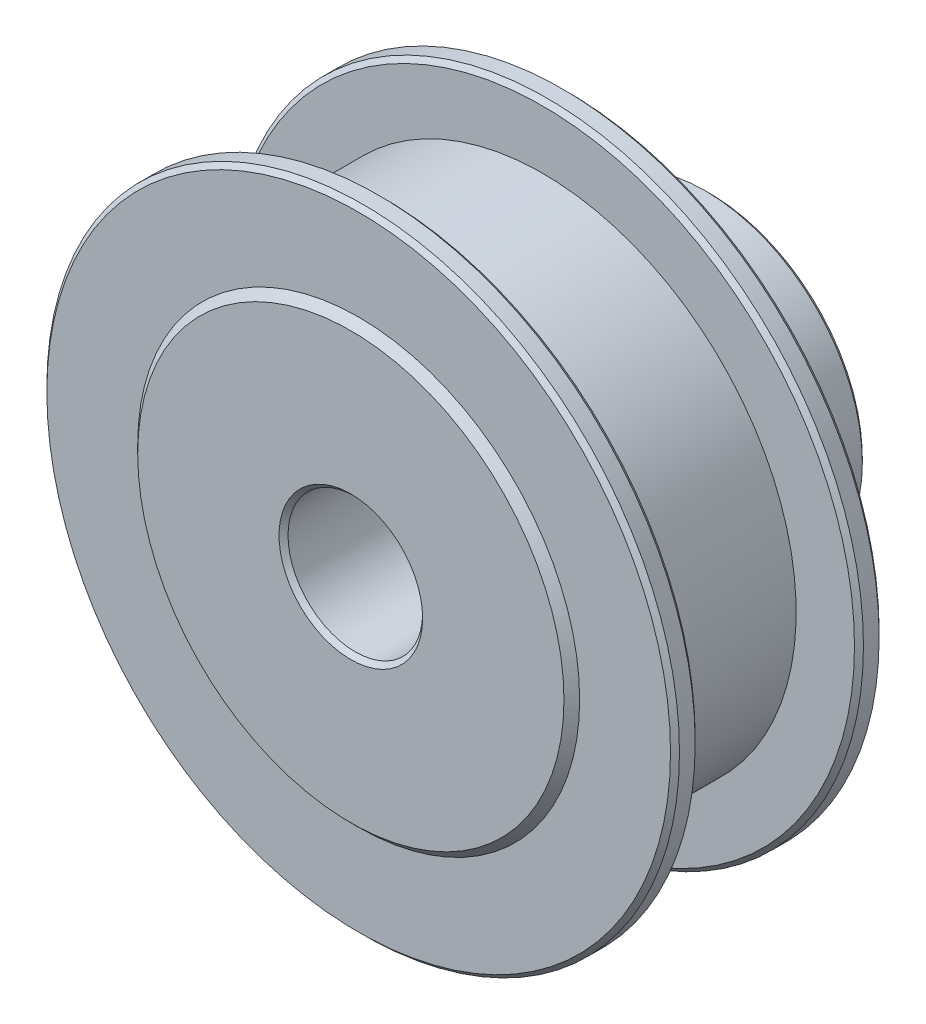
from build123d import *

# Parameters (mm, degrees)
SKETCH1_R                = 14.1
BOSS_EXTRUDE1_DEPTH      = 9.3
SKETCH2_W                = 7.1
SKETCH2_H                = 2.8
BOSS_EXTRUDE2_DEPTH      = 0.35
BOSS_EXTRUDE2_DEPTH_BACK = 9.65
SKETCH3_R                = 9.85
CHAMFER1_SIZE            = 0.35
SKETCH4_R                = 7
BOSS_EXTRUDE3_DEPTH      = 6
CUT_EXTRUDE1_REACH       = 27.566
SKETCH5_R                = 3
CHAMFER2_SIZE            = 0.2


with BuildPart() as part:
    # Sketch1 → Boss-Extrude1 (new body)
    with BuildSketch(Plane.XY):
        Circle(SKETCH1_R)
    extrude(amount=BOSS_EXTRUDE1_DEPTH)

    # Sketch2 → Cut-Revolve1 (revolve, cut)
    with BuildSketch(Plane(origin=(0, 0, 0), x_dir=(0, 0, -1), z_dir=(1, 0, 0)), mode=Mode.PRIVATE) as cut_revolve1_sk:
        with Locations((-4.65, 12.7)):
            Rectangle(SKETCH2_W, SKETCH2_H)
    revolve(cut_revolve1_sk.sketch.rotate(Axis((0, 0, -195813.923931263), (0, 0, -1)), 270), axis=Axis((0, 0, -195813.923931263), (0, 0, -1)), mode=Mode.SUBTRACT)

    # Sketch3 → Boss-Extrude2 (add, two sides: drawn at the far end of the back side and taken through both)
    with BuildSketch(Plane.XY.offset(9.3).offset(-BOSS_EXTRUDE2_DEPTH_BACK)):
        Circle(SKETCH3_R)
    extrude(amount=BOSS_EXTRUDE2_DEPTH + BOSS_EXTRUDE2_DEPTH_BACK)

    # Chamfer1
    chamfer1_edges = [part.edges().sort_by_distance(p)[0] for p in [
        (-9.85, 0, -0.35),
        (-9.85, 0, 9.65),
    ]]
    chamfer(chamfer1_edges, length=CHAMFER1_SIZE - 0.0001)  # a hair under: the kernel refuses the full size

    # Sketch4 → Boss-Extrude3 (add)
    with BuildSketch(Plane(origin=(0, 0, -0.35), x_dir=(-1, 0, 0), z_dir=(0, 0, -1))):
        with Locations(Location((0, 0, 0), (0, 0, 180))):
            Circle(SKETCH4_R)
    extrude(amount=BOSS_EXTRUDE3_DEPTH)

    # Sketch5 → Cut-Extrude1 (cut, up to next)
    with BuildSketch(Plane(origin=(0, 0, -6.35), x_dir=(-1, 0, 0), z_dir=(0, 0, -1)), mode=Mode.PRIVATE) as cut_extrude1_sk1:
        Circle(SKETCH5_R)
    cut_extrude1_tool1 = extrude(cut_extrude1_sk1.sketch, amount=-CUT_EXTRUDE1_REACH, mode=Mode.PRIVATE) & part.part
    add(cut_extrude1_tool1.solids().sort_by_distance((0, 0, -6.35))[0], mode=Mode.SUBTRACT)

    # Chamfer2
    chamfer2_edges = [part.edges().sort_by_distance(p)[0] for p in [
        (-14.1, 0, 0),
        (-7, 0, -6.35),
        (3, 0, 9.65),
        (3, 0, -6.35),
        (-14.1, 0, 9.3),
        (-14.1, 0, 1.1),
        (-14.1, 0, 8.2),
    ]]
    chamfer(chamfer2_edges, length=CHAMFER2_SIZE)


solid = part.part
